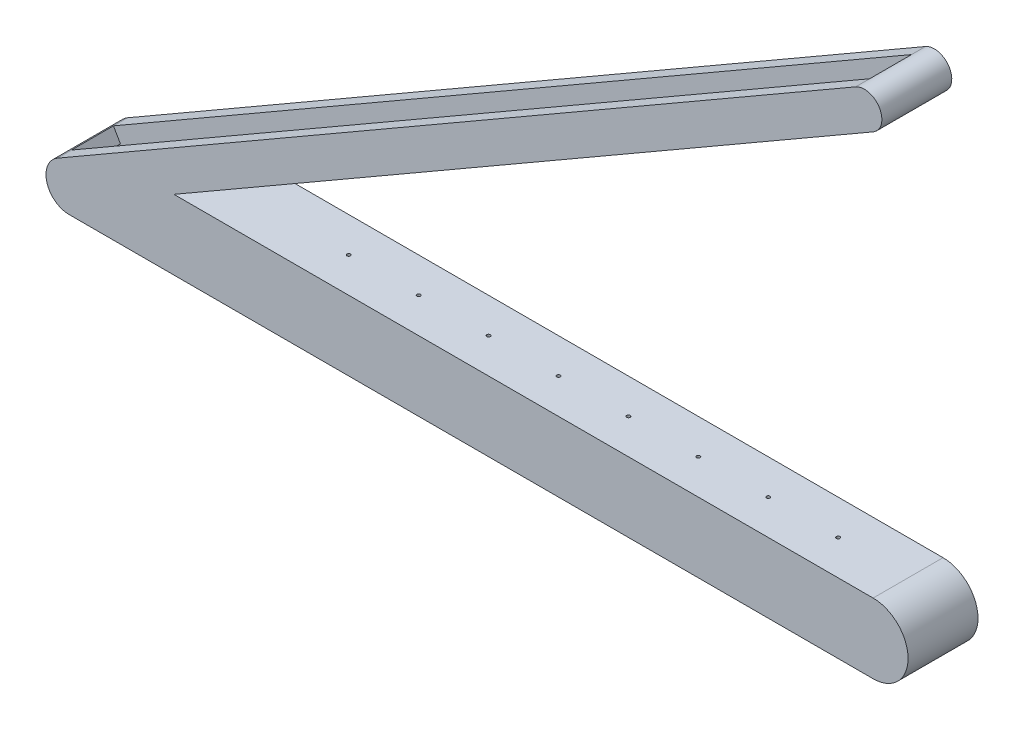
from build123d import *

# Parameters (mm, degrees)
BOSS_EXTRUDE1_DEPTH     = 100
SHELL1_START            = 20
SHELL1_DEPTH            = 60
CUT_EXTRUDE5_DEPTH      = 700
CUT_EXTRUDE5_DEPTH_BACK = 1226.510966311
SKETCH3_R               = 2.5


# Read off the part's stored shape, not the designer's step: Shell1
with BuildPart() as part:
    # Sketch1 → Boss-Extrude1 (new body)
    with BuildSketch(Plane.XY):
        with BuildLine():
            Line((0, 0), (1000, 0))
            ThreePointArc((1000, 0), (1050, -50), (1000, -100))
            Line((1000, -100), (-150, -100))
            ThreePointArc((-150, -100), (-181.887821353, -75.531614088), (-166.506350946, -38.397459622))
            Line((-166.506350946, -38.397459622), (975, 620.651539379))
            ThreePointArc((975, 620.651539379), (1009.150635095, 611.500904284), (1000, 577.35026919))
            Line((1000, 577.35026919), (0, 0))
        make_face()
    extrude(amount=BOSS_EXTRUDE1_DEPTH)

    # Shell1 outline → Shell1 (cut)
    with BuildSketch(Plane.XY.offset(SHELL1_START)):
        with BuildLine():
            Line((-150, -80), (-150, -100))
            Line((-150, -100), (1000, -100))
            Line((1000, -100), (1000, -80))
            ThreePointArc((1000, -80), (1030, -50), (1000, -20))
            Line((1000, -20), (-74.641016151, -20))
            Line((-74.641016151, -20), (990, 594.670777265))
            ThreePointArc((990, 594.670777265), (991.830127019, 601.500904284), (985, 603.331031303))
            Line((985, 603.331031303), (975, 620.651539379))
            Line((975, 620.651539379), (-166.506350946, -38.397459622))
            Line((-166.506350946, -38.397459622), (-156.506350946, -55.717967697))
            ThreePointArc((-156.506350946, -55.717967697), (-162.569304827, -70.355233185), (-150, -80))
        make_face()
    extrude(amount=SHELL1_DEPTH, mode=Mode.SUBTRACT)

    # Sketch3 → Cut-Extrude5 (cut, two sides: drawn at the far end of the back side and taken through both)
    with BuildSketch(Plane(origin=(0, 0, 0), x_dir=(1, 0, 0), z_dir=(0, 1, 0)).offset(-CUT_EXTRUDE5_DEPTH_BACK)):
        with Locations(Location((200, -50, 0), (0, 0, 90))):
            Circle(SKETCH3_R)
        with Locations(Location((300, -50, 0), (0, 0, 90))):
            Circle(SKETCH3_R)
        with Locations(Location((400, -50, 0), (0, 0, 90))):
            Circle(SKETCH3_R)
        with Locations(Location((500, -50, 0), (0, 0, 90))):
            Circle(SKETCH3_R)
        with Locations(Location((600, -50, 0), (0, 0, 90))):
            Circle(SKETCH3_R)
        with Locations(Location((700, -50, 0), (0, 0, 90))):
            Circle(SKETCH3_R)
        with Locations(Location((800, -50, 0), (0, 0, 90))):
            Circle(SKETCH3_R)
        with Locations(Location((900, -50, 0), (0, 0, 90))):
            Circle(SKETCH3_R)
    extrude(amount=CUT_EXTRUDE5_DEPTH + CUT_EXTRUDE5_DEPTH_BACK, mode=Mode.SUBTRACT)


solid = part.part
